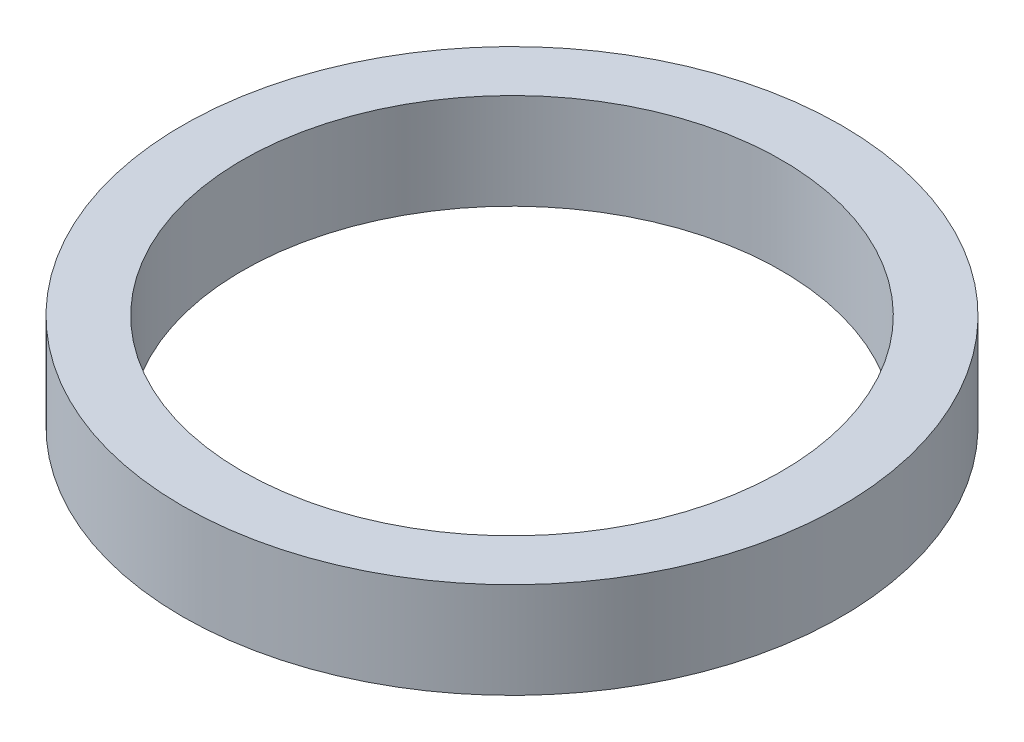
from build123d import *

# Parameters (mm, degrees)
SKETCH1_R           = 55
BOSS_EXTRUDE1_DEPTH = 16
SKETCH2_R           = 45
CUT_EXTRUDE1_DEPTH  = 80.410326784


with BuildPart() as part:
    # Sketch1 → Boss-Extrude1 (new body)
    with BuildSketch(Plane(origin=(0, 0, 0), x_dir=(1, 0, 0), z_dir=(0, 1, 0))):
        Circle(SKETCH1_R)
    extrude(amount=BOSS_EXTRUDE1_DEPTH)

    # Sketch2 → Cut-Extrude1 (cut, through all)
    with BuildSketch(Plane(origin=(0, 0, 0), x_dir=(1, 0, 0), z_dir=(0, 1, 0))):
        Circle(SKETCH2_R)
    extrude(amount=CUT_EXTRUDE1_DEPTH, mode=Mode.SUBTRACT)


solid = part.part
